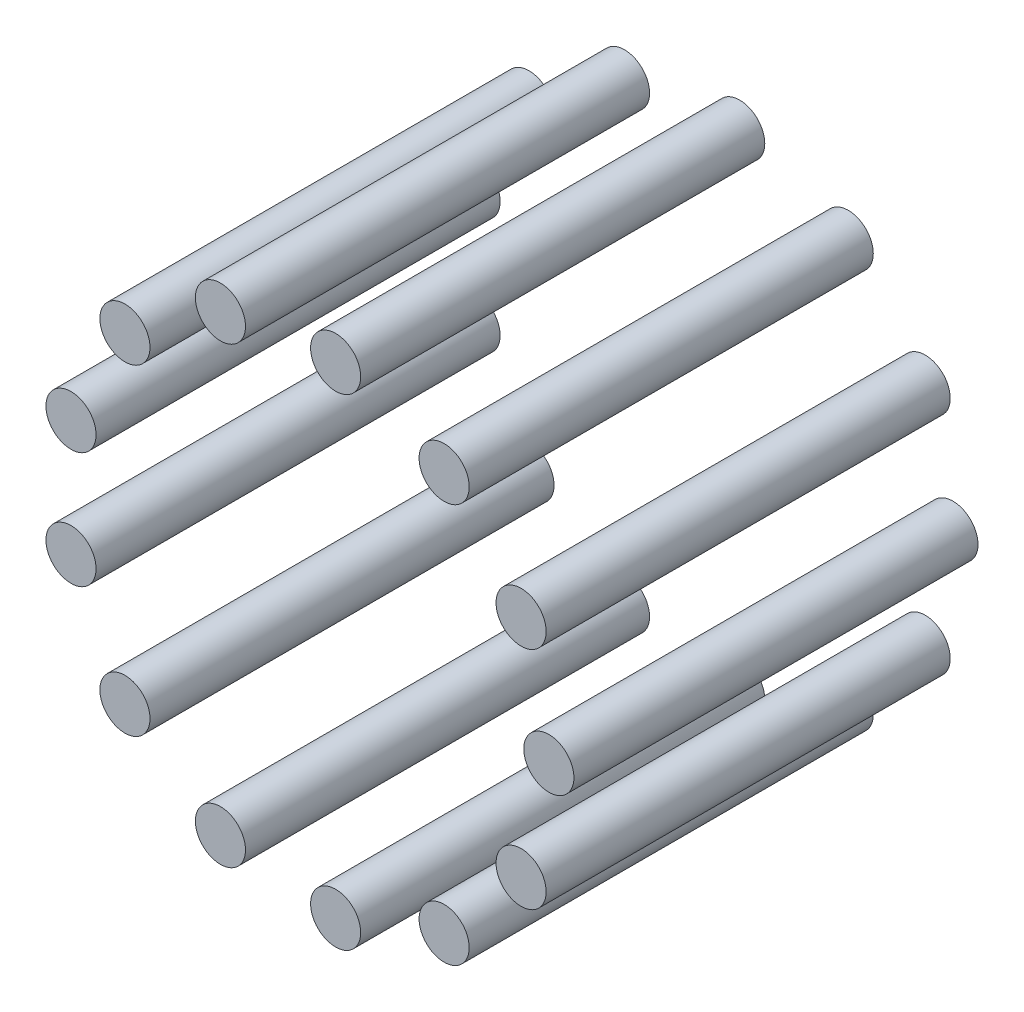
from build123d import *

# Parameters (mm, degrees)
SKETCH1_R              = 3.1
BOSS_EXTRUDE1_DEPTH    = 50
BOSS_EXTRUDE1_2_DEPTH  = 50
BOSS_EXTRUDE1_3_DEPTH  = 50
BOSS_EXTRUDE1_4_DEPTH  = 50
BOSS_EXTRUDE1_5_DEPTH  = 50
BOSS_EXTRUDE1_6_DEPTH  = 50
BOSS_EXTRUDE1_7_DEPTH  = 50
BOSS_EXTRUDE1_8_DEPTH  = 50
BOSS_EXTRUDE1_9_DEPTH  = 50
BOSS_EXTRUDE1_10_DEPTH = 50
BOSS_EXTRUDE1_11_DEPTH = 50
BOSS_EXTRUDE1_12_DEPTH = 50
BOSS_EXTRUDE1_13_DEPTH = 50


with BuildPart() as part:
    # Sketch1 → Boss-Extrude1 (new body)
    with BuildSketch(Plane.XY):
        with Locations((30, 0)):
            Circle(SKETCH1_R)
    extrude(amount=BOSS_EXTRUDE1_DEPTH)


with BuildPart() as body_2:
    # Sketch1 → Boss-Extrude1 2 (new body)
    with BuildSketch(Plane.XY):
        with Locations((26.56368077, -13.941695161)):
            Circle(SKETCH1_R)
    extrude(amount=BOSS_EXTRUDE1_2_DEPTH)


with BuildPart() as body_3:
    # Sketch1 → Boss-Extrude1 3 (new body)
    with BuildSketch(Plane.XY):
        with Locations((17.041942402, -24.689515977)):
            Circle(SKETCH1_R)
    extrude(amount=BOSS_EXTRUDE1_3_DEPTH)


with BuildPart() as body_4:
    # Sketch1 → Boss-Extrude1 4 (new body)
    with BuildSketch(Plane.XY):
        with Locations((3.616100408, -29.781266223)):
            Circle(SKETCH1_R)
    extrude(amount=BOSS_EXTRUDE1_4_DEPTH)


with BuildPart() as body_5:
    # Sketch1 → Boss-Extrude1 5 (new body)
    with BuildSketch(Plane.XY):
        with Locations((-10.638146611, -28.050487281)):
            Circle(SKETCH1_R)
    extrude(amount=BOSS_EXTRUDE1_5_DEPTH)


with BuildPart() as body_6:
    # Sketch1 → Boss-Extrude1 6 (new body)
    with BuildSketch(Plane.XY):
        with Locations((-22.455322445, -19.893679747)):
            Circle(SKETCH1_R)
    extrude(amount=BOSS_EXTRUDE1_6_DEPTH)


with BuildPart() as body_7:
    # Sketch1 → Boss-Extrude1 7 (new body)
    with BuildSketch(Plane.XY):
        with Locations((-29.128254523, -7.179469929)):
            Circle(SKETCH1_R)
    extrude(amount=BOSS_EXTRUDE1_7_DEPTH)


with BuildPart() as body_8:
    # Sketch1 → Boss-Extrude1 8 (new body)
    with BuildSketch(Plane.XY):
        with Locations((-29.128254523, 7.179469929)):
            Circle(SKETCH1_R)
    extrude(amount=BOSS_EXTRUDE1_8_DEPTH)


with BuildPart() as body_9:
    # Sketch1 → Boss-Extrude1 9 (new body)
    with BuildSketch(Plane.XY):
        with Locations((-22.455322445, 19.893679747)):
            Circle(SKETCH1_R)
    extrude(amount=BOSS_EXTRUDE1_9_DEPTH)


with BuildPart() as body_10:
    # Sketch1 → Boss-Extrude1 10 (new body)
    with BuildSketch(Plane.XY):
        with Locations((-10.638146611, 28.050487281)):
            Circle(SKETCH1_R)
    extrude(amount=BOSS_EXTRUDE1_10_DEPTH)


with BuildPart() as body_11:
    # Sketch1 → Boss-Extrude1 11 (new body)
    with BuildSketch(Plane.XY):
        with Locations((3.616100408, 29.781266223)):
            Circle(SKETCH1_R)
    extrude(amount=BOSS_EXTRUDE1_11_DEPTH)


with BuildPart() as body_12:
    # Sketch1 → Boss-Extrude1 12 (new body)
    with BuildSketch(Plane.XY):
        with Locations((17.041942402, 24.689515977)):
            Circle(SKETCH1_R)
    extrude(amount=BOSS_EXTRUDE1_12_DEPTH)


with BuildPart() as body_13:
    # Sketch1 → Boss-Extrude1 13 (new body)
    with BuildSketch(Plane.XY):
        with Locations((26.56368077, 13.941695161)):
            Circle(SKETCH1_R)
    extrude(amount=BOSS_EXTRUDE1_13_DEPTH)


solid = Compound([part.part, body_2.part, body_3.part, body_4.part, body_5.part, body_6.part, body_7.part, body_8.part, body_9.part, body_10.part, body_11.part, body_12.part, body_13.part])
